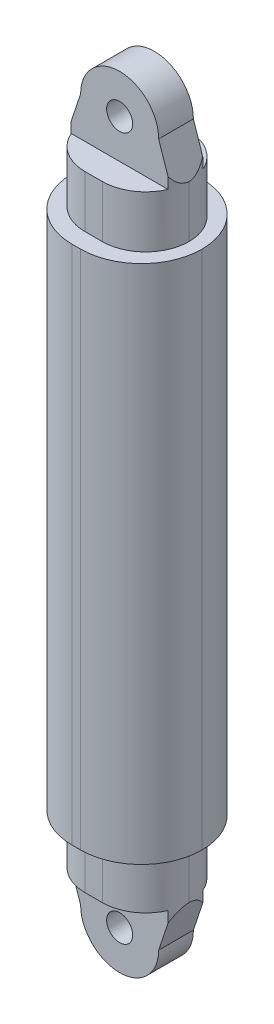
from build123d import *

# Parameters (mm, degrees)
SKETCH2_W                = 12
SKETCH2_H                = 90
BOSS_EXTRUDE1_DEPTH      = 10
FILLET1_R                = 5
CUT_EXTRUDE1_DEPTH       = 3
CUT_EXTRUDE2_START       = 7
SKETCH3_2_W              = 12
SKETCH3_2_H              = 9
CUT_EXTRUDE2_DEPTH       = 3
CUT_EXTRUDE4_START       = -4
CUT_EXTRUDE4_DEPTH       = 51.486557197
SKETCH7_R                = 1.5
CUT_EXTRUDE5_DEPTH       = 46.934736311
BOSS_EXTRUDE2_DEPTH      = 7
BOSS_EXTRUDE2_DEPTH_BACK = 7
SKETCH9_W                = 15
SKETCH9_H                = 60
FILLET3_R                = 7


with BuildPart() as part:
    # Sketch2 → Boss-Extrude1 (new body)
    with BuildSketch(Plane.XY):
        Rectangle(SKETCH2_W, SKETCH2_H)
    extrude(amount=BOSS_EXTRUDE1_DEPTH)

    # Fillet1
    fillet1_edges = [part.edges().sort_by_distance(p)[0] for p in [
        (-6, 0, 0),
        (6, 0, 0),
        (6, 0, 10),
        (-6, 0, 10),
    ]]
    fillet(fillet1_edges, radius=FILLET1_R - 0.0001)  # a hair under: the kernel refuses the full size

    # Sketch3 → Cut-Extrude1 (cut)
    with BuildSketch(Plane.XY):
        with BuildLine():
            Line((-6, -36), (-4.5, -40.5))
            ThreePointArc((-4.5, -40.5), (0, -45), (4.5, -40.5))
            Line((4.5, -40.5), (6, -36))
            Line((6, -36), (-6, -36))
        make_face()
        with BuildLine():
            Line((-3.9e-08, -45), (6, -45))
            Line((6, -45), (6, -36))
            Line((6, -36), (4.5, -40.5))
            ThreePointArc((4.5, -40.5), (3.181980501, -43.681980529), (-3.9e-08, -45))
        make_face()
        with BuildLine():
            Line((-6, -45), (-3.9e-08, -45))
            ThreePointArc((-3.9e-08, -45), (-3.181980529, -43.681980501), (-4.5, -40.5))
            Line((-4.5, -40.5), (-6, -36))
            Line((-6, -36), (-6, -45))
        make_face()
    cut_extrude1 = extrude(amount=CUT_EXTRUDE1_DEPTH, mode=Mode.SUBTRACT)

    # Sketch3<2> → Cut-Extrude2 (cut)
    with BuildSketch(Plane.XY.offset(CUT_EXTRUDE2_START)):
        with Locations((0, -40.5)):
            Rectangle(SKETCH3_2_W, SKETCH3_2_H)
    cut_extrude2 = extrude(amount=CUT_EXTRUDE2_DEPTH, mode=Mode.SUBTRACT)

    # Mirror1: Cut-Extrude1, Cut-Extrude2 across plane
    add(cut_extrude1.mirror(Plane.ZX), mode=Mode.SUBTRACT)
    add(cut_extrude2.mirror(Plane.ZX), mode=Mode.SUBTRACT)

    # Sketch3<4> → Cut-Extrude4 (cut)
    with BuildSketch(Plane.XY.offset(CUT_EXTRUDE4_START)):
        with BuildLine():
            Line((-3.9e-08, -45), (6, -45))
            Line((6, -45), (6, -36))
            Line((6, -36), (4.5, -40.5))
            ThreePointArc((4.5, -40.5), (3.181980501, -43.681980529), (-3.9e-08, -45))
        make_face()
        with BuildLine():
            Line((-6, -45), (-3.9e-08, -45))
            ThreePointArc((-3.9e-08, -45), (-3.181980529, -43.681980501), (-4.5, -40.5))
            Line((-4.5, -40.5), (-6, -36))
            Line((-6, -36), (-6, -45))
        make_face()
    cut_extrude4 = extrude(amount=CUT_EXTRUDE4_DEPTH, mode=Mode.SUBTRACT)

    # Sketch7 → Cut-Extrude5 (cut, through all)
    with BuildSketch(Plane(origin=(0, 0, 3), x_dir=(-1, 0, 0), z_dir=(0, 0, -1))):
        with Locations((0, -40.5)):
            Circle(SKETCH7_R)
    cut_extrude5 = extrude(amount=-CUT_EXTRUDE5_DEPTH, mode=Mode.SUBTRACT)

    # Mirror3: Cut-Extrude5 across plane
    add(cut_extrude5.mirror(Plane.ZX), mode=Mode.SUBTRACT)

    # Mirror4: Cut-Extrude4 across plane
    add(cut_extrude4.mirror(Plane.ZX), mode=Mode.SUBTRACT)

    # Sketch9 → Boss-Extrude2 (add, two sides: drawn at the far end of the back side and taken through both)
    with BuildSketch(Plane.XY.offset(5).offset(-BOSS_EXTRUDE2_DEPTH_BACK)):
        Rectangle(SKETCH9_W, SKETCH9_H)
    extrude(amount=BOSS_EXTRUDE2_DEPTH + BOSS_EXTRUDE2_DEPTH_BACK)

    # Fillet3
    fillet3_edges = [part.edges().sort_by_distance(p)[0] for p in [
        (-7.5, 0, 12),
        (7.5, 0, 12),
        (7.5, 0, -2),
        (-7.5, 0, -2),
    ]]
    fillet(fillet3_edges, radius=FILLET3_R - 0.0001)  # a hair under: the kernel refuses the full size


solid = part.part
